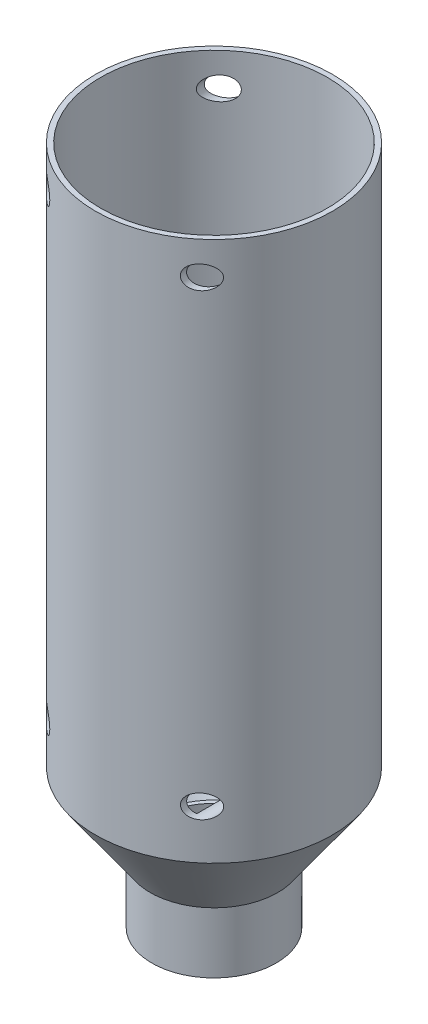
from build123d import *
from build123d.topology import SkipClean

# Parameters (mm, degrees)
BOSS_EXTRUDE1_REACH     = 133.784
BOSS_EXTRUDE1_START     = 0.2
SKETCH5_R               = 0.925
BOSS_EXTRUDE3_REACH     = 133.816
BOSS_EXTRUDE3_START     = 0.3
SKETCH7_R               = 0.925
CUT_EXTRUDE1_DEPTH      = 132.515984345
CUT_EXTRUDE1_DEPTH_BACK = 132.515984345
SKETCH8_R               = 0.925
SKETCH13_R              = 23
SKETCH13_R_2            = 22
BOSS_EXTRUDE7_DEPTH     = 4.5
SKETCH14_R              = 2.25
CUT_EXTRUDE2_DEPTH      = 14
CUT_EXTRUDE3_START      = -14
SKETCH15_R              = 2.25
CUT_EXTRUDE3_DEPTH      = 14


with BuildPart() as part:
    # Sketch1 → Revolve1 (revolve)
    with BuildSketch(Plane.XY):
        Polygon((-12.065, 0), (-12.065, 12), (-12.369, 12), (-23, 27), (-23, 127.318433846), (-22, 127.318433846), (-22, 27.318433846), (-11.852048652, 13), (-11.065, 13), (-11.065, 0), align=None)
    revolve(axis=Axis((0, 0, 0), (0, 1, 0)))

    # Sketch5 → Boss-Extrude1 (add, up to next)
    with BuildSketch(Plane.XY.offset(0.989185927).offset(BOSS_EXTRUDE1_START), mode=Mode.PRIVATE) as boss_extrude1_sk1:
        Polygon((-22, 38.387269329), (-22, 27.318433846), (-13.809084588, 33.175910624), (-13.809084588, 38.387269329), (-22, 46.578184741), align=None)
        with Locations((-14.929084588, 36.513433846)):
            Circle(SKETCH5_R, mode=Mode.SUBTRACT)
    boss_extrude1_tool1 = extrude(boss_extrude1_sk1.sketch, amount=BOSS_EXTRUDE1_REACH, mode=Mode.PRIVATE) - part.part
    # Sketch5 → Boss-Extrude1 (add, up to next)
    with BuildSketch(Plane.XY.offset(0.989185927).offset(BOSS_EXTRUDE1_START), mode=Mode.PRIVATE) as boss_extrude1_sk2:
        Polygon((22, 38.387269329), (22, 27.318433846), (13.809084588, 33.175910624), (13.809084588, 38.387269329), (22, 46.578184741), align=None)
        with Locations((14.929084588, 36.513433846)):
            Circle(SKETCH5_R, mode=Mode.SUBTRACT)
    boss_extrude1_tool2 = extrude(boss_extrude1_sk2.sketch, amount=BOSS_EXTRUDE1_REACH, mode=Mode.PRIVATE) - part.part
    add(boss_extrude1_tool1.solids().sort_by_distance((-18.791854, 36.475566, 1.189186))[0])
    add(boss_extrude1_tool2.solids().sort_by_distance((18.791854, 36.475566, 1.189186))[0])


with BuildPart() as body_2:

    # Sketch7 → Boss-Extrude3 (new, up to next)
    with BuildSketch(Plane(origin=(0, 0, -0.610814073), x_dir=(-1, 0, 0), z_dir=(0, 0, -1)).offset(BOSS_EXTRUDE3_START), mode=Mode.PRIVATE) as boss_extrude3_sk1:
        Polygon((-22, 27.318433846), (-13.809084588, 33.175910624), (-13.809084588, 38.387269329), (-22, 46.578184741), (-22, 38.387269329), align=None)
        with Locations((-14.929084588, 36.513433846)):
            Circle(SKETCH7_R, mode=Mode.SUBTRACT)
    boss_extrude3_tool1 = extrude(boss_extrude3_sk1.sketch, amount=BOSS_EXTRUDE3_REACH, mode=Mode.PRIVATE) - part.part
    # Sketch7 → Boss-Extrude3 (new, up to next)
    with BuildSketch(Plane(origin=(0, 0, -0.610814073), x_dir=(-1, 0, 0), z_dir=(0, 0, -1)).offset(BOSS_EXTRUDE3_START), mode=Mode.PRIVATE) as boss_extrude3_sk2:
        Polygon((13.809084588, 33.175910624), (13.809084588, 38.387269329), (22, 46.578184741), (22, 38.387269329), (22, 27.318433846), align=None)
        with Locations((14.929084588, 36.513433846)):
            Circle(SKETCH7_R, mode=Mode.SUBTRACT)
    boss_extrude3_tool2 = extrude(boss_extrude3_sk2.sketch, amount=BOSS_EXTRUDE3_REACH, mode=Mode.PRIVATE) - part.part
    add(boss_extrude3_tool1.solids().sort_by_distance((18.791854, 36.475566, -0.910814))[0])
    add(boss_extrude3_tool2.solids().sort_by_distance((-18.791854, 36.475566, -0.910814))[0])


with BuildPart() as part_1:
    add(part.part)

    # Sketch8 → Cut-Extrude1 (cut, two sides: drawn at the far end of the back side and taken through both)
    with BuildSketch(Plane(origin=(0, 0, -0.610814073), x_dir=(-1, 0, 0), z_dir=(0, 0, -1)).offset(-CUT_EXTRUDE1_DEPTH_BACK)):
        with Locations((-14.915915412, 125.413433846)):
            Circle(SKETCH8_R)
        with Locations((14.929084588, 125.413433846)):
            Circle(SKETCH8_R)
        with Locations((-14.929084588, 36.513433846)):
            Circle(SKETCH8_R)
        with Locations((14.929084588, 36.513433846)):
            Circle(SKETCH8_R)
    extrude(amount=CUT_EXTRUDE1_DEPTH + CUT_EXTRUDE1_DEPTH_BACK, mode=Mode.SUBTRACT)

    # Sketch13 → Boss-Extrude7 (add)
    with SkipClean():  # the faces are left unmerged after this step: merging them gives an invalid solid
        with BuildSketch(Plane(origin=(0, 127.318433846, 0), x_dir=(1, 0, 0), z_dir=(0, 1, 0))):
            Circle(SKETCH13_R)
            Circle(SKETCH13_R_2, mode=Mode.SUBTRACT)
        extrude(amount=BOSS_EXTRUDE7_DEPTH)


with BuildPart() as cut_extrude2_tool:
    # Sketch14 → Cut-Extrude2 (new body)
    with SkipClean():  # the faces are left unmerged after this step: merging them gives an invalid solid
        with BuildSketch(Plane(origin=(0, 0, -23), x_dir=(-1, 0, 0), z_dir=(0, 0, -1))):
            with Locations((-14.915915412, 125.413433846)):
                Circle(SKETCH14_R)
            with Locations((14.929084588, 125.413433846)):
                Circle(SKETCH14_R)
            with Locations((14.929084588, 36.513433846)):
                Circle(SKETCH14_R)
            with Locations((-14.929084588, 36.513433846)):
                Circle(SKETCH14_R)
        extrude(amount=-CUT_EXTRUDE2_DEPTH)


with BuildPart() as part_2:
    with SkipClean():  # the faces are left unmerged after this step: merging them gives an invalid solid
        add(part_1.part)

        # Cut-Extrude2: cut by cut_extrude2_tool
        add(cut_extrude2_tool.part, mode=Mode.SUBTRACT)

    # Sketch15 → Cut-Extrude3 (cut)
    with SkipClean():  # the faces are left unmerged after this step: merging them gives an invalid solid
        with BuildSketch(Plane.XY.offset(23).offset(CUT_EXTRUDE3_START)):
            with Locations((14.915915412, 125.413433846)):
                Circle(SKETCH15_R)
            with Locations((-14.929084588, 125.413433846)):
                Circle(SKETCH15_R)
            with Locations((14.929084588, 36.513433846)):
                Circle(SKETCH15_R)
            with Locations((-14.929084588, 36.513433846)):
                Circle(SKETCH15_R)
        extrude(amount=CUT_EXTRUDE3_DEPTH, mode=Mode.SUBTRACT)


with BuildPart() as body_2_1:
    with SkipClean():  # the faces are left unmerged after this step: merging them gives an invalid solid
        add(body_2.part)

        # Cut-Extrude2: cut by cut_extrude2_tool
        add(cut_extrude2_tool.part, mode=Mode.SUBTRACT)


solid = Compound([part_2.part, body_2_1.part])
